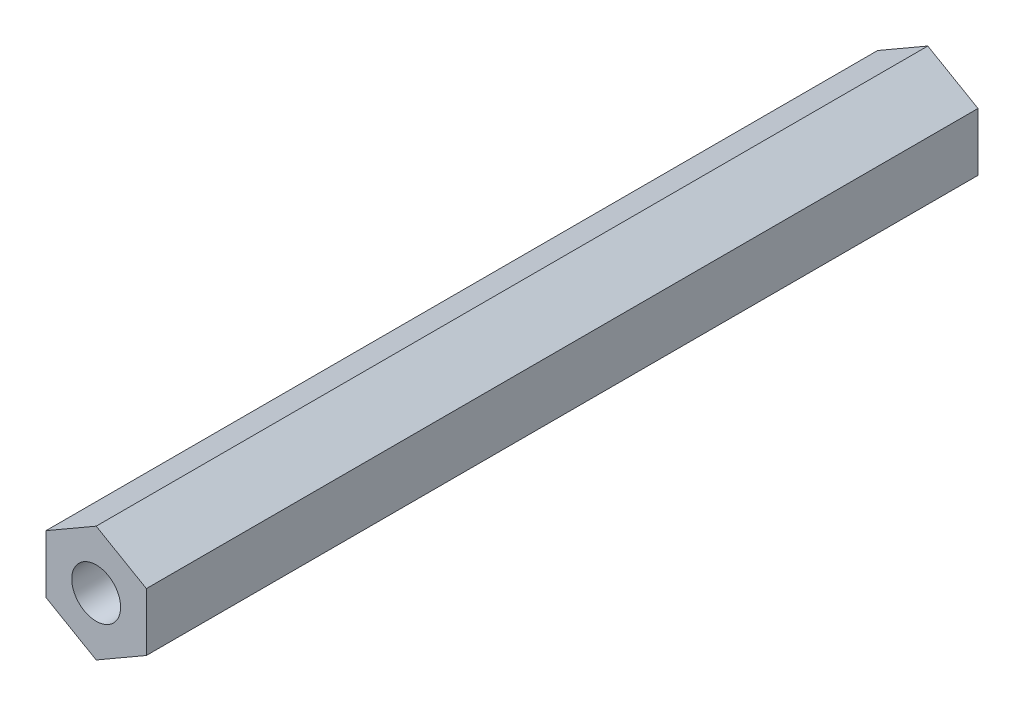
from build123d import *

# Parameters (mm, degrees)
BOSS_EXTRUDE1_DEPTH = 46.0375
SKETCH3_R           = 2.7051
CUT_EXTRUDE1_DEPTH  = 38.1
CUT_EXTRUDE2_START  = -38.1
SKETCH4_R           = 2.7051
CUT_EXTRUDE2_DEPTH  = 38.1


with BuildPart() as part:
    # Sketch2 → Boss-Extrude1 (new, symmetric)
    with BuildSketch(Plane.XY):
        Polygon((0, 6.415804866), (-5.55625, 3.207902433), (-5.55625, -3.207902433), (0, -6.415804866), (5.55625, -3.207902433), (5.55625, 3.207902433), align=None)
    extrude(amount=BOSS_EXTRUDE1_DEPTH, both=True)

    # Sketch3 → Cut-Extrude1 (cut)
    with BuildSketch(Plane.XY.offset(46.0375)):
        Circle(SKETCH3_R)
    extrude(amount=-CUT_EXTRUDE1_DEPTH, mode=Mode.SUBTRACT)

    # Sketch4 → Cut-Extrude2 (cut)
    with BuildSketch(Plane(origin=(0, 0, -46.0375), x_dir=(-1, 0, 0), z_dir=(0, 0, -1)).offset(CUT_EXTRUDE2_START)):
        Circle(SKETCH4_R)
    extrude(amount=CUT_EXTRUDE2_DEPTH, mode=Mode.SUBTRACT)


solid = part.part
